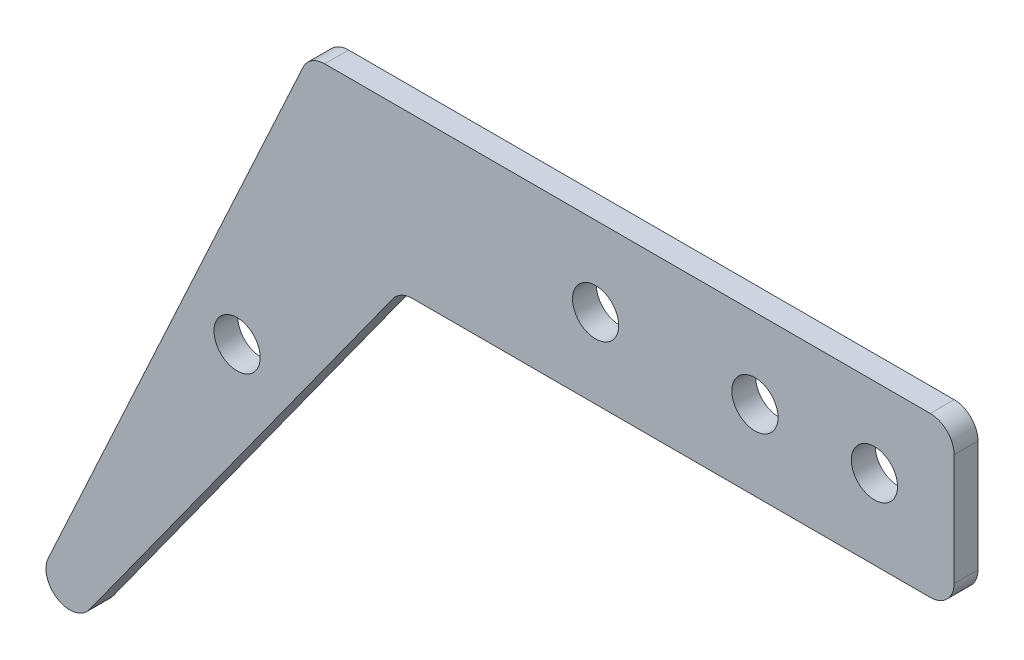
from build123d import *

# Parameters (mm, degrees)
BOSS_EXTRU_1_DEPTH       = 3
D_GAGEMENT_START         = -3
D_GAGEMENT_M51_OUTLINE_R = 2.9
D_GAGEMENT_M51_DEPTH     = 3


# Read off the part's stored shape, not the designer's step: Dégagement M51
with BuildPart() as part:
    # Esquisse1 → Boss.-Extru.1 (new body)
    with BuildSketch(Plane.XY):
        with BuildLine():
            Line((-6.724255553, 8.256356511), (-38.711792489, -61.104708083))
            ThreePointArc((-38.711792489, -61.104708083), (-37.5, -64.951905284), (-33.554116714, -64.115620384))
            Line((-33.554116714, -64.115620384), (4.566579778, -11.24544421))
            ThreePointArc((4.566579778, -11.24544421), (5.633191193, -10.329450677), (7, -10))
            Line((7, -10), (72, -10))
            ThreePointArc((72, -10), (74.121320344, -9.121320344), (75, -7))
            Line((75, -7), (75, 7))
            ThreePointArc((75, 7), (74.121320344, 9.121320344), (72, 10))
            Line((72, 10), (-4, 10))
            ThreePointArc((-4, 10), (-5.617240005, 9.526763694), (-6.724255553, 8.256356511))
        make_face()
    extrude(amount=-BOSS_EXTRU_1_DEPTH)

    # Dégagement M51 outline → Dégagement M51 (cut)
    with BuildSketch(Plane.XY.offset(D_GAGEMENT_START)):
        with Locations((65, 0)):
            Circle(D_GAGEMENT_M51_OUTLINE_R)
        with Locations((50, 0)):
            Circle(D_GAGEMENT_M51_OUTLINE_R)
        with Locations((-15, -25.980762114)):
            Circle(D_GAGEMENT_M51_OUTLINE_R)
        with Locations((30, 0)):
            Circle(D_GAGEMENT_M51_OUTLINE_R)
    extrude(amount=D_GAGEMENT_M51_DEPTH, mode=Mode.SUBTRACT)


solid = part.part
